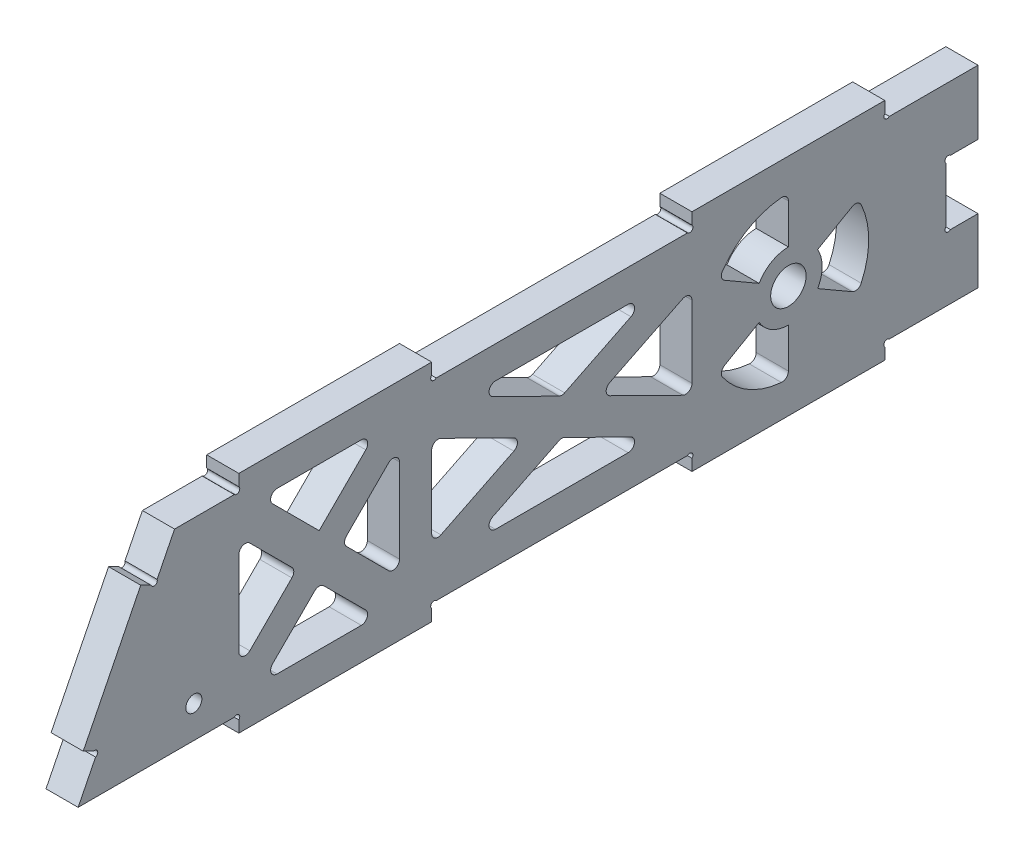
from build123d import *

# Parameters (mm, degrees)
SKETCH1_W               = 355.6
SKETCH1_H               = 76.2
BOSS_EXTRUDE1_DEPTH     = 12.7
CUT_EXTRUDE1_DEPTH      = 183.279291199
CUT_EXTRUDE1_DEPTH_BACK = 183.279291199
SKETCH3_W               = 76.2
SKETCH3_H               = 6.35
BOSS_EXTRUDE2_DEPTH     = 12.7
SKETCH4_W               = 12.7
SKETCH4_H               = 25.4
CUT_EXTRUDE2_DEPTH      = 184.711546997
SKETCH5_R               = 7
CUT_EXTRUDE3_DEPTH      = 184.711546997
CUT_EXTRUDE4_DEPTH      = 184.711546997
BOSS_EXTRUDE3_DEPTH     = 12.7
SKETCH9_R               = 1.27
CUT_EXTRUDE6_DEPTH      = 184.711546997
CUT_EXTRUDE7_DEPTH      = 184.711546997
FILLET1_R               = 2.54
FILLET2_R               = 2.54
SKETCH11_R              = 3.175
CUT_EXTRUDE8_DEPTH      = 184.711546997


with BuildPart() as part:
    # Sketch1 → Boss-Extrude1 (new body)
    with BuildSketch(Plane(origin=(0, 0, 0), x_dir=(0, 0, -1), z_dir=(1, 0, 0))):
        Rectangle(SKETCH1_W, SKETCH1_H)
    extrude(amount=BOSS_EXTRUDE1_DEPTH)

    # Sketch2 → Cut-Extrude1 (cut, two sides: drawn at the far end of the back side and taken through both)
    with BuildSketch(Plane(origin=(12.7, 0, 0), x_dir=(0, 0, -1), z_dir=(1, 0, 0)).offset(-CUT_EXTRUDE1_DEPTH_BACK)):
        Polygon((-507.550847217, -697.601694433), (-177.8, -38.1), (-139.7, 38.1), (190.050847217, 697.601694433), (-1128.95254165, 1357.103388866), (-1826.554236083, -38.1), align=None)
    extrude(amount=CUT_EXTRUDE1_DEPTH + CUT_EXTRUDE1_DEPTH_BACK, mode=Mode.SUBTRACT)

    # Sketch3 → Boss-Extrude2 (add)
    with BuildSketch(Plane.ZY):
        with Locations((-102.87, -41.275)):
            Rectangle(SKETCH3_W, SKETCH3_H)
        with Locations((76.2, -41.275)):
            Rectangle(SKETCH3_W, SKETCH3_H)
        with Locations((-102.87, 41.275)):
            Rectangle(SKETCH3_W, SKETCH3_H)
        with Locations((76.2, 41.275)):
            Rectangle(SKETCH3_W, SKETCH3_H)
    extrude(amount=-BOSS_EXTRUDE2_DEPTH)

    # Sketch4 → Cut-Extrude2 (cut, through all)
    with BuildSketch(Plane.ZY):
        with Locations((-171.45, 0)):
            Rectangle(SKETCH4_W, SKETCH4_H)
    extrude(amount=-CUT_EXTRUDE2_DEPTH, mode=Mode.SUBTRACT)

    # Sketch5 → Cut-Extrude3 (cut, through all)
    with BuildSketch(Plane.ZY):
        with Locations((-102.87, 0)):
            Circle(SKETCH5_R)
    extrude(amount=-CUT_EXTRUDE3_DEPTH, mode=Mode.SUBTRACT)

    # Sketch6 → Cut-Extrude4 (cut, through all)
    with BuildSketch(Plane.ZY):
        Polygon((23.758802297, 25.4), (-50.428802297, 25.4), (-13.335, 7.08207294), align=None)
        Polygon((-27.676197703, 0), (-64.77, 18.31792706), (-64.77, -18.31792706), align=None)
        Polygon((38.1, -18.31792706), (38.1, 18.31792706), (1.006197703, 0), align=None)
        Polygon((-13.335, -7.08207294), (-50.428802297, -25.4), (23.758802297, -25.4), align=None)
        Polygon((105.319743879, 31.75), (59.780256121, 31.75), (82.55, 8.980256121), align=None)
        Polygon((73.569743879, 0), (50.8, 22.769743879), (50.8, -22.769743879), align=None)
        Polygon((114.3, 22.769743879), (91.530256121, 0), (114.3, -22.769743879), align=None)
        Polygon((105.319743879, -31.75), (82.55, -8.980256121), (59.780256121, -31.75), align=None)
    extrude(amount=-CUT_EXTRUDE4_DEPTH, mode=Mode.SUBTRACT)

    # Sketch8 → Boss-Extrude3 (add)
    with BuildSketch(Plane(origin=(12.7, 0, 0), x_dir=(0, 0, -1), z_dir=(1, 0, 0))):
        Polygon((-147.390774674, 22.718450651), (-170.109225326, -22.718450651), (-175.788837989, -19.87864432), (-153.070387337, 25.558256983), align=None)
    extrude(amount=-BOSS_EXTRUDE3_DEPTH)

    # Sketch9 → Cut-Extrude6 (cut, through all)
    with BuildSketch(Plane.ZY):
        with Locations((-165.998025612, 11.801974388)):
            Circle(SKETCH9_R)
        with Locations((-165.998025612, -11.801974388)):
            Circle(SKETCH9_R)
        with Locations((-141.868025612, 38.998025612)):
            Circle(SKETCH9_R)
        with Locations((-141.868025612, -38.998025612)):
            Circle(SKETCH9_R)
        with Locations((-63.871974388, -38.998025612)):
            Circle(SKETCH9_R)
        with Locations((-63.871974388, 38.998025612)):
            Circle(SKETCH9_R)
        with Locations((37.201974388, 38.998025612)):
            Circle(SKETCH9_R)
        with Locations((37.201974388, -38.998025612)):
            Circle(SKETCH9_R)
        with Locations((115.198025612, -38.998025612)):
            Circle(SKETCH9_R)
        with Locations((115.198025612, 38.998025612)):
            Circle(SKETCH9_R)
        with Locations((147.792383937, 23.92327844)):
            Circle(SKETCH9_R)
        with Locations((171.314053114, -23.120059914)):
            Circle(SKETCH9_R)
    extrude(amount=-CUT_EXTRUDE6_DEPTH, mode=Mode.SUBTRACT)

    # Sketch10 → Cut-Extrude7 (cut, through all)
    with BuildSketch(Plane.ZY):
        with BuildLine():
            Line((-130.36630657, -15.875), (-114.431439141, -6.675))
            ThreePointArc((-114.431439141, -6.675), (-116.22, 0), (-114.431439141, 6.675))
            Line((-114.431439141, 6.675), (-130.36630657, 15.875))
            ThreePointArc((-130.36630657, 15.875), (-134.62, 0), (-130.36630657, -15.875))
        make_face()
        with BuildLine():
            ThreePointArc((-91.308560859, -6.675), (-96.195, -11.561439141), (-102.87, -13.35))
            Line((-102.87, -13.35), (-102.87, -31.75))
            ThreePointArc((-102.87, -31.75), (-86.995, -27.49630657), (-75.37369343, -15.875))
            Line((-75.37369343, -15.875), (-91.308560859, -6.675))
        make_face()
        with BuildLine():
            Line((-102.87, 31.75), (-102.87, 13.35))
            ThreePointArc((-102.87, 13.35), (-96.195, 11.561439141), (-91.308560859, 6.675))
            Line((-91.308560859, 6.675), (-75.37369343, 15.875))
            ThreePointArc((-75.37369343, 15.875), (-86.995, 27.49630657), (-102.87, 31.75))
        make_face()
    extrude(amount=-CUT_EXTRUDE7_DEPTH, mode=Mode.SUBTRACT)

    # Fillet1
    fillet1_edges = [part.edges().sort_by_distance(p)[0] for p in [
        (6.35, 15.875, -75.37369343),
        (6.35, 31.75, -102.87),
        (6.35, -31.75, -102.87),
        (6.35, -15.875, -75.37369343),
        (6.35, 15.875, -130.36630657),
        (6.35, -15.875, -130.36630657),
    ]]
    fillet(fillet1_edges, radius=FILLET1_R)

    # Fillet2
    fillet2_edges = [part.edges().sort_by_distance(p)[0] for p in [
        (6.35, 18.31792706, -64.77),
        (6.35, -18.31792706, -64.77),
        (6.35, -25.4, -50.428802297),
        (6.35, -25.4, 23.758802297),
        (6.35, 0, -27.676197703),
        (6.35, 0, 1.006197703),
        (6.35, -7.08207294, -13.335),
        (6.35, 18.31792706, 38.1),
        (6.35, -18.31792706, 38.1),
        (6.35, 7.08207294, -13.335),
        (6.35, 25.4, 23.758802297),
        (6.35, 25.4, -50.428802297),
        (6.35, -31.75, 59.780256121),
        (6.35, -31.75, 105.319743879),
        (6.35, 22.769743879, 50.8),
        (6.35, -22.769743879, 50.8),
        (6.35, -22.769743879, 114.3),
        (6.35, -8.980256121, 82.55),
        (6.35, 22.769743879, 114.3),
        (6.35, 0, 73.569743879),
        (6.35, 31.75, 105.319743879),
        (6.35, 0, 91.530256121),
        (6.35, 31.75, 59.780256121),
    ]]
    fillet(fillet2_edges, radius=FILLET2_R)

    # Sketch11 → Cut-Extrude8 (cut, through all)
    with BuildSketch(Plane(origin=(12.7, 0, 0), x_dir=(0, 0, -1), z_dir=(1, 0, 0))):
        with Locations((-132.08, -25.4)):
            Circle(SKETCH11_R)
    extrude(amount=-CUT_EXTRUDE8_DEPTH, mode=Mode.SUBTRACT)


solid = part.part
